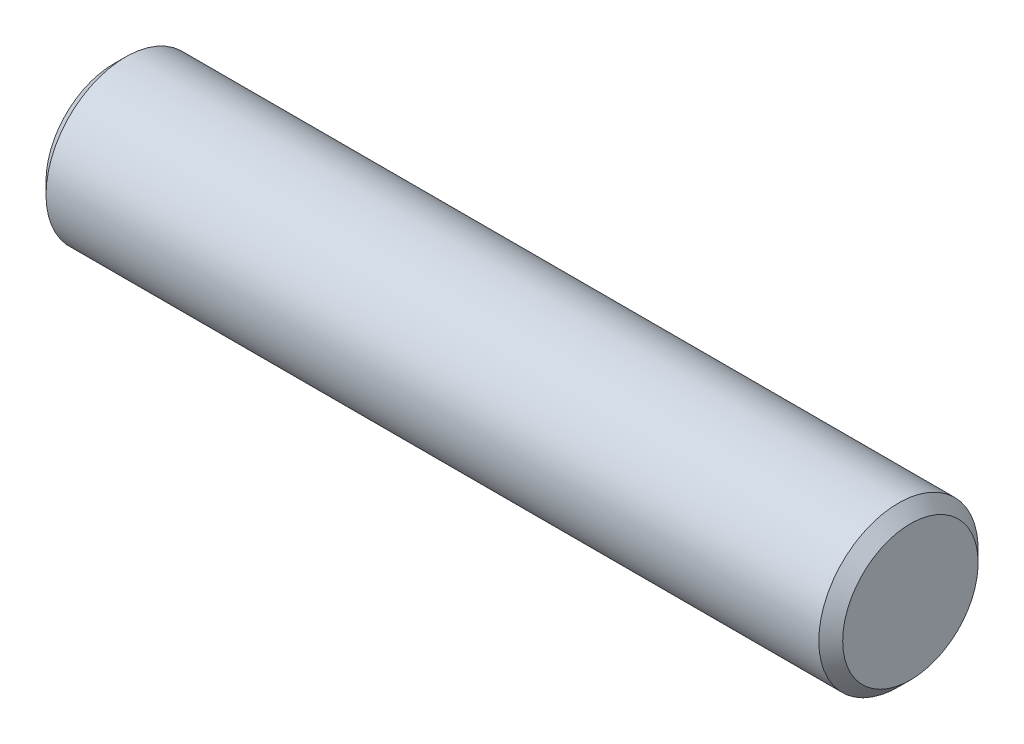
from build123d import *


with BuildPart() as part:
    # BodySke → BaseBody (revolve)
    with BuildSketch(Plane.XY):
        Polygon((1.5, 10), (0, 8.5), (0, 0), (100, 0), (100, 8.5), (98.5, 10), align=None)
    revolve(axis=Axis((-3.175, 0, 0), (1, 0, 0)))


solid = part.part
